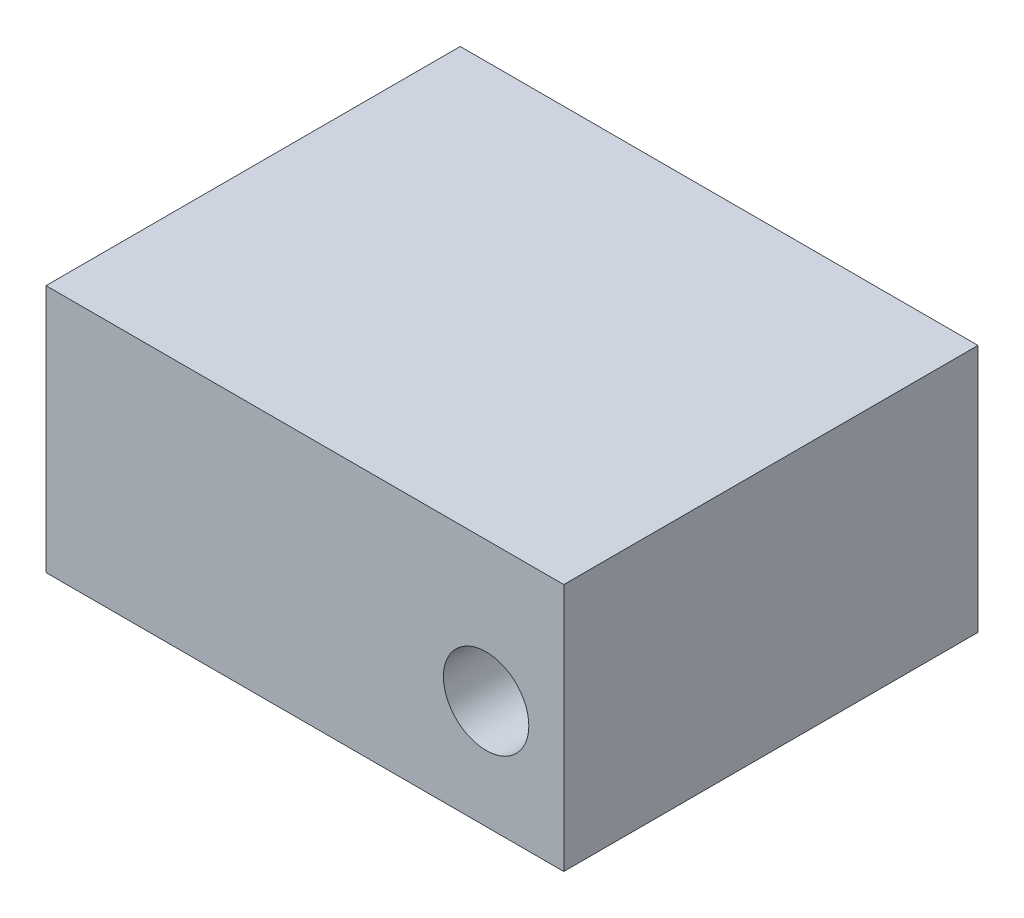
from build123d import *

# Parameters (mm, degrees)
SKETCH1_R           = 1.65
BOSS_EXTRUDE1_DEPTH = 16


with BuildPart() as part:
    # Sketch1 → Boss-Extrude1 (new body)
    with BuildSketch(Plane.XY.offset(60.279798331)):
        Polygon((4, -14.752526313), (20, -14.752526313), (24, -14.752526313), (24, -5.152526313), (4, -5.152526313), align=None)
        with Locations((20.999999999, -10.552525988)):
            Circle(SKETCH1_R, mode=Mode.SUBTRACT)
    extrude(amount=-BOSS_EXTRUDE1_DEPTH)


solid = part.part
